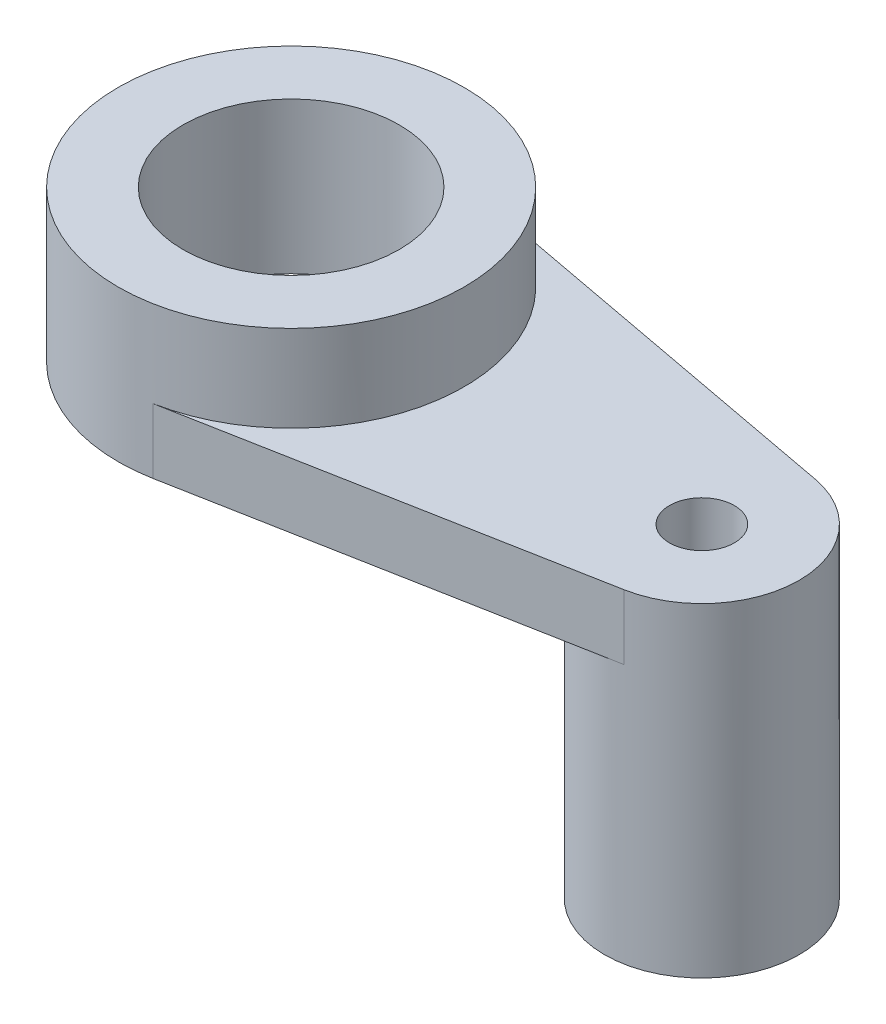
from build123d import *

# Parameters (mm, degrees)
SKETCH1_R           = 3
SKETCH1_R_2         = 10
BOSS_EXTRUDE1_DEPTH = 6
SKETCH1_3_R         = 10
BOSS_EXTRUDE2_DEPTH = 14
BOSS_EXTRUDE3_START = -24
SKETCH1_4_R         = 3
BOSS_EXTRUDE3_DEPTH = 24


with BuildPart() as part:
    # Sketch1 → Boss-Extrude1 (new body)
    with BuildSketch(Plane(origin=(0, 0, 0), x_dir=(1, 0, 0), z_dir=(0, 1, 0))):
        with BuildLine():
            Line((2.947368421, -15.726188966), (39.657894737, -8.845981293))
            ThreePointArc((39.657894737, -8.845981293), (47, 0), (39.657894737, 8.845981293))
            Line((39.657894737, 8.845981293), (2.947368421, 15.726188966))
            ThreePointArc((2.947368421, 15.726188966), (-16, 0), (2.947368421, -15.726188966))
        make_face()
        with Locations((38, 0)):
            Circle(SKETCH1_R, mode=Mode.SUBTRACT)
        Circle(SKETCH1_R_2, mode=Mode.SUBTRACT)
    extrude(amount=BOSS_EXTRUDE1_DEPTH)

    # Sketch1<3> → Boss-Extrude2 (add)
    with BuildSketch(Plane(origin=(0, 0, 0), x_dir=(1, 0, 0), z_dir=(0, 1, 0))):
        with BuildLine():
            ThreePointArc((16, 0), (12.311740225, 10.218661979), (2.947368421, 15.726188966))
            ThreePointArc((2.947368421, 15.726188966), (-16, 0), (2.947368421, -15.726188966))
            ThreePointArc((2.947368421, -15.726188966), (12.311740225, -10.218661979), (16, 0))
        make_face()
        Circle(SKETCH1_3_R, mode=Mode.SUBTRACT)
    extrude(amount=BOSS_EXTRUDE2_DEPTH)

    # Sketch1<4> → Boss-Extrude3 (add)
    with BuildSketch(Plane(origin=(0, 0, 0), x_dir=(1, 0, 0), z_dir=(0, 1, 0)).offset(BOSS_EXTRUDE3_START)):
        with BuildLine():
            ThreePointArc((47, 0), (44.925353877, 5.747997363), (39.657894737, 8.845981293))
            ThreePointArc((39.657894737, 8.845981293), (29, 0), (39.657894737, -8.845981293))
            ThreePointArc((39.657894737, -8.845981293), (44.925353877, -5.747997363), (47, 0))
        make_face()
        with Locations((38, 0)):
            Circle(SKETCH1_4_R, mode=Mode.SUBTRACT)
    extrude(amount=BOSS_EXTRUDE3_DEPTH)


solid = part.part
